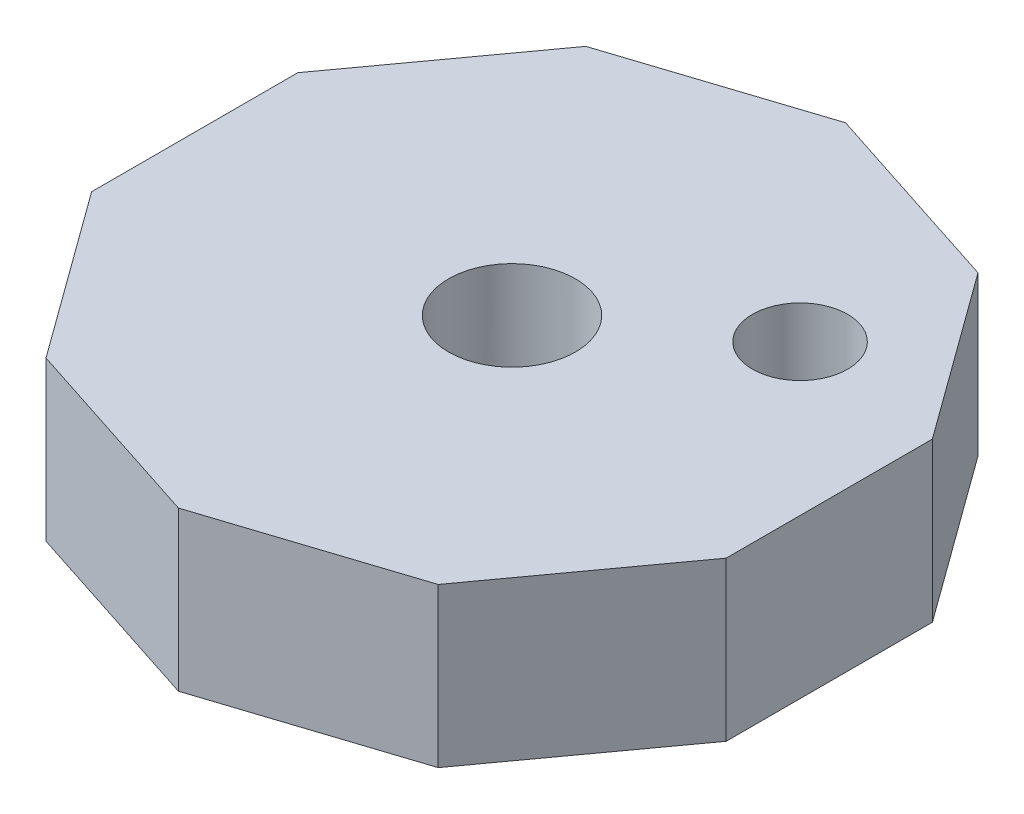
from build123d import *

# Parameters (mm, degrees)
BOSS_EXTRUDE1_DEPTH = 5
SKETCH2_R           = 1.5
SKETCH2_R_2         = 2
CUT_EXTRUDE1_DEPTH  = 5
SKETCH4_R           = 3
CUT_EXTRUDE2_DEPTH  = 1.5


with BuildPart() as part:
    # Sketch1 → Boss-Extrude1 (new body)
    with BuildSketch(Plane(origin=(0, 0, 0), x_dir=(1, 0, 0), z_dir=(0, 1, 0))):
        Polygon((6.180339887, -8.506508084), (10, -3.249196962), (10, 3.249196962), (6.180339887, 8.506508084), (0, 10.514622242), (-6.180339887, 8.506508084), (-10, 3.249196962), (-10, -3.249196962), (-6.180339887, -8.506508084), (0, -10.514622242), align=None)
    extrude(amount=BOSS_EXTRUDE1_DEPTH)

    # Sketch2 → Cut-Extrude1 (cut)
    with BuildSketch(Plane(origin=(0, 5, 0), x_dir=(1, 0, 0), z_dir=(0, 1, 0))):
        with Locations((5.258610463, 3.82060414)):
            Circle(SKETCH2_R)
        Circle(SKETCH2_R_2)
    extrude(amount=-CUT_EXTRUDE1_DEPTH, mode=Mode.SUBTRACT)

    # Sketch4 → Cut-Extrude2 (cut)
    with BuildSketch(Plane.XZ):
        Circle(SKETCH4_R)
    extrude(amount=-CUT_EXTRUDE2_DEPTH, mode=Mode.SUBTRACT)


solid = part.part
